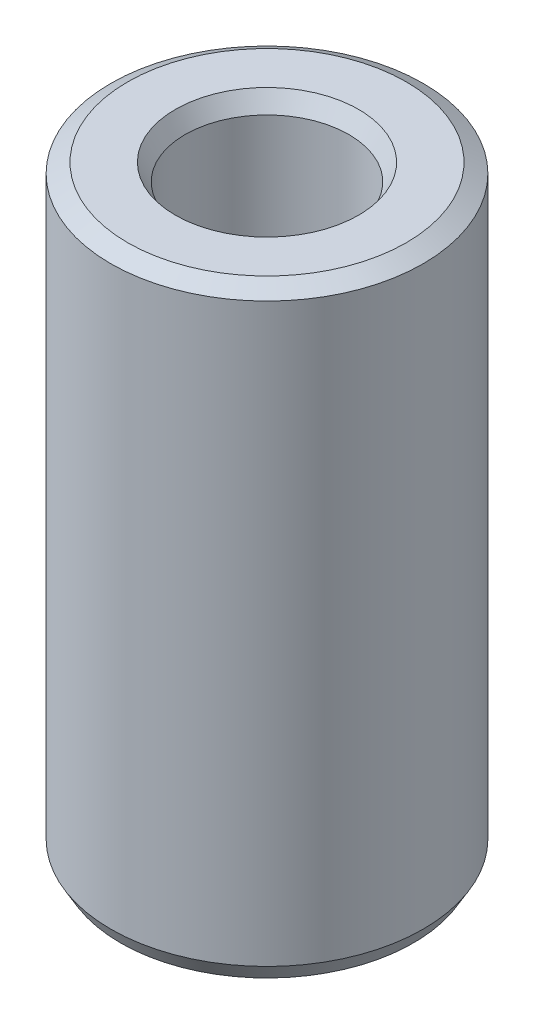
from build123d import *
from OCP.BRepFilletAPI import BRepFilletAPI_MakeChamfer

# Parameters (mm, degrees)
SKETCH1_R           = 60
BOSS_EXTRUDE1_DEPTH = 231.571872817
SKETCH2_R           = 31.462923706
CUT_EXTRUDE1_DEPTH  = 247.628328219
CHAMFER1_SIZE       = 3.744188742
CHAMFER1_SIZE2      = 6.485125133


with BuildPart() as part:
    # Sketch1 → Boss-Extrude1 (new body)
    with BuildSketch(Plane(origin=(0, 0, 0), x_dir=(1, 0, 0), z_dir=(0, 1, 0))):
        Circle(SKETCH1_R)
    extrude(amount=BOSS_EXTRUDE1_DEPTH)

    # Sketch2 → Cut-Extrude1 (cut, through all)
    with BuildSketch(Plane(origin=(0, 0, 0), x_dir=(1, 0, 0), z_dir=(0, 1, 0))):
        Circle(SKETCH2_R)
    extrude(amount=CUT_EXTRUDE1_DEPTH, mode=Mode.SUBTRACT)

    # Chamfer1: one chamfer whose edges measure the first distance from different faces: ONE call of the kernel's chamfer builder (chamfer() names one face for all edges)
    chamfer1_edges_1 = [part.edges().sort_by_distance(p)[0] for p in [
        (-31.462923706, 231.571872817, 0),
    ]]
    chamfer1_side_1 = [part.faces().sort_by_distance(p)[0] for p in [
        (-58.302943725, 231.571872817, 0),
    ]]
    chamfer1_edges_2 = [part.edges().sort_by_distance(p)[0] for p in [
        (-31.462923706, 0, 0),
    ]]
    chamfer1_side_2 = [part.faces().sort_by_distance(p)[0] for p in [
        (-31.462923706, 115.785936409, 0),
    ]]
    chamfer1_edges_3 = [part.edges().sort_by_distance(p)[0] for p in [
        (-60, 0, 0),
    ]]
    chamfer1_side_3 = [part.faces().sort_by_distance(p)[0] for p in [
        (-58.302943725, 0, 0),
    ]]
    chamfer1_edges_4 = [part.edges().sort_by_distance(p)[0] for p in [
        (-60, 231.571872817, 0),
    ]]
    chamfer1_side_4 = [part.faces().sort_by_distance(p)[0] for p in [
        (-60, 115.785936409, 0),
    ]]
    chamfer1 = BRepFilletAPI_MakeChamfer(part.part.solid().wrapped)
    for e in chamfer1_edges_1:
        chamfer1.Add(CHAMFER1_SIZE, CHAMFER1_SIZE2, e.wrapped, chamfer1_side_1[0].wrapped)  # the first distance lies on this face
    for e in chamfer1_edges_2:
        chamfer1.Add(CHAMFER1_SIZE, CHAMFER1_SIZE2, e.wrapped, chamfer1_side_2[0].wrapped)  # the first distance lies on this face
    for e in chamfer1_edges_3:
        chamfer1.Add(CHAMFER1_SIZE, CHAMFER1_SIZE2, e.wrapped, chamfer1_side_3[0].wrapped)  # the first distance lies on this face
    for e in chamfer1_edges_4:
        chamfer1.Add(CHAMFER1_SIZE, CHAMFER1_SIZE2, e.wrapped, chamfer1_side_4[0].wrapped)  # the first distance lies on this face
    add(Compound.cast(chamfer1.Shape()), mode=Mode.REPLACE)


solid = part.part
